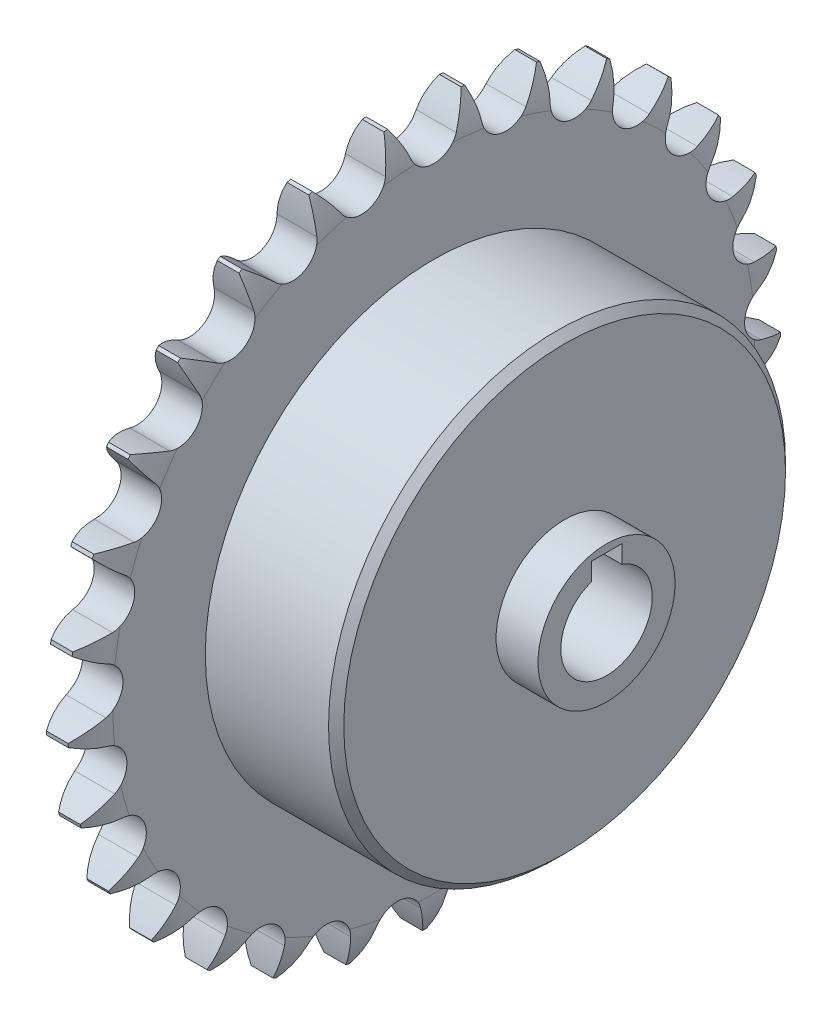
from build123d import *

# Parameters (mm, degrees)
TOOTHCUT_DEPTH      = 67.436416291
TEETHCUTS_COUNT     = 29
TEETHCUTS_ANGLE     = 347.586206897
BORSKE_R            = 10
BORE_DEPTH          = 50.0005
SKETCH1_R           = 30
SKETCH1_R_2         = 6
BOSS_EXTRUDE1_DEPTH = 24.6804
SKETCH2_R           = 10
SKETCH2_R_2         = 6
BOSS_EXTRUDE2_DEPTH = 5.3196
SKETCH3_W           = 4
SKETCH3_H           = 4
CUT_EXTRUDE1_DEPTH  = 73.665372308
SKETCH5_OUTSIDE_W   = 122.652
SKETCH5_OUTSIDE_H   = 122.515
SKETCH5_OUTSIDE_R   = 9
CUT_EXTRUDE3_DEPTH  = 7.5
CHAMFER1_SIZE       = 1
SKETCH6_R           = 12.521476026
CUT_EXTRUDE4_DEPTH  = 2


with BuildPart() as part:
    # BasProSke → Base-Revolve (revolve)
    with BuildSketch(Plane(origin=(0, 0, 0), x_dir=(1, 0, 0), z_dir=(0, 1, 0)), mode=Mode.PRIVATE) as base_revolve_sk:
        with BuildLine():
            Line((0, 0), (0, 42.13092815))
            ThreePointArc((0, 42.13092815), (0.314698702, 44.559091036), (1.238, 46.826804639))
            Line((1.238, 46.826804639), (4.0816, 46.826804639))
            ThreePointArc((4.0816, 46.826804639), (5.004901298, 44.559091036), (5.3196, 42.13092815))
            Line((5.3196, 42.13092815), (5.3196, 0))
            Line((5.3196, 0), (0, 0))
        make_face()
    revolve(base_revolve_sk.sketch.rotate(Axis((-10, 0, 0), (1, 0, 0)), 180), axis=Axis((-10, 0, 0), (1, 0, 0)))

    # TooCutSke → ToothCut (cut, through all)
    with BuildSketch(Plane(origin=(0, 0, 0), x_dir=(0, 0, -1), z_dir=(1, 0, 0))):
        with BuildLine():
            ThreePointArc((2.982554331, 42.90245883), (3.946377791, 45.028760973), (5.115378775, 47.049541308))
            ThreePointArc((5.115378775, 47.049541308), (0, 47.326804639), (-5.115378775, 47.049541308))
            ThreePointArc((-5.115378775, 47.049541308), (-3.946377791, 45.028760973), (-2.982554331, 42.90245883))
            ThreePointArc((-2.982554331, 42.90245883), (0, 40.873679639), (2.982554331, 42.90245883))
        make_face()
    toothcut = extrude(amount=TOOTHCUT_DEPTH, mode=Mode.SUBTRACT)

    # TeethCuts: ToothCut ×29 about axis
    teethcuts_axis = Axis((-10, 0, 0), (1, 0, 0))
    for i in range(1, TEETHCUTS_COUNT):
        add(toothcut.rotate(teethcuts_axis, i * TEETHCUTS_ANGLE / (TEETHCUTS_COUNT - 1)), mode=Mode.SUBTRACT)

    # BorSke → Bore (cut, symmetric)
    with BuildSketch(Plane(origin=(0, 0, 0), x_dir=(0, 0, -1), z_dir=(1, 0, 0))):
        with Locations(Location((0, 0, 0), (0, 0, 180))):
            Circle(BORSKE_R)
    extrude(amount=BORE_DEPTH, both=True, mode=Mode.SUBTRACT)

    # Sketch1 → Boss-Extrude1 (add)
    with BuildSketch(Plane(origin=(5.3196, 0, 0), x_dir=(0, 0, -1), z_dir=(1, 0, 0))):
        with Locations(Location((0, 0, 0), (0, 0, 180))):
            Circle(SKETCH1_R)
        Circle(SKETCH1_R_2, mode=Mode.SUBTRACT)
    extrude(amount=BOSS_EXTRUDE1_DEPTH)

    # Sketch2 → Boss-Extrude2 (add)
    with BuildSketch(Plane.ZY.offset(-5.3196)):
        Circle(SKETCH2_R)
        with Locations(Location((0, 0, 0), (0, 0, 180))):
            Circle(SKETCH2_R_2, mode=Mode.SUBTRACT)
    extrude(amount=BOSS_EXTRUDE2_DEPTH)

    # Sketch3 → Cut-Extrude1 (cut, through all)
    with BuildSketch(Plane(origin=(30, 0, 0), x_dir=(0, 0, -1), z_dir=(1, 0, 0))):
        with Locations((0, 6)):
            Rectangle(SKETCH3_W, SKETCH3_H)
    extrude(amount=-CUT_EXTRUDE1_DEPTH, mode=Mode.SUBTRACT)

    # Sketch5 outside → Cut-Extrude3 (cut)
    with BuildSketch(Plane(origin=(30, 0, 0), x_dir=(0, 0, -1), z_dir=(1, 0, 0))):
        with Locations((0, -0.1245)):
            Rectangle(SKETCH5_OUTSIDE_W, SKETCH5_OUTSIDE_H)
        Circle(SKETCH5_OUTSIDE_R, mode=Mode.SUBTRACT)
    extrude(amount=-CUT_EXTRUDE3_DEPTH, mode=Mode.SUBTRACT)

    # Chamfer1
    chamfer1_edges = [part.edges().sort_by_distance(p)[0] for p in [
        (22.5, 0, -30),
    ]]
    chamfer(chamfer1_edges, length=CHAMFER1_SIZE)

    # Sketch6 → Cut-Extrude4 (cut)
    with BuildSketch(Plane(origin=(30, 0, 0), x_dir=(0, 0, -1), z_dir=(1, 0, 0))):
        Circle(SKETCH6_R)
    extrude(amount=-CUT_EXTRUDE4_DEPTH, mode=Mode.SUBTRACT)


solid = part.part
